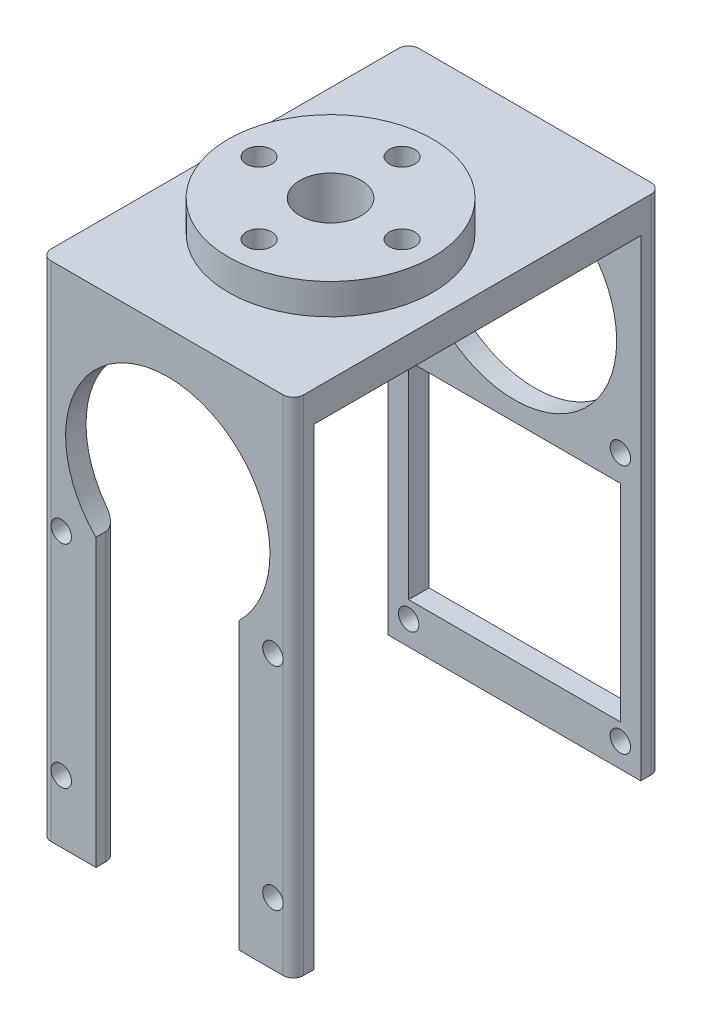
from build123d import *

# Parameters (mm, degrees)
SKETCH_1_W          = 24.72
SKETCH_1_H          = 49.22
EXTRUDE_1_DEPTH     = 36
SKETCH_3_W          = 24.72
SKETCH_3_H          = 32
CUT_EXTRUDE_1_DEPTH = 46.22
SKETCH_4_R          = 1
SKETCH_4_R_2        = 10
SKETCH_4_W          = 20.72
SKETCH_4_H          = 20.22
CUT_EXTRUDE_2_DEPTH = 2
SKETCH_6_R          = 1
CUT_EXTRUDE_3_DEPTH = 6
SKETCH_7_R          = 10
EXTRUDE_2_DEPTH     = 3
SKETCH_8_R          = 1.25
CUT_EXTRUDE_4_DEPTH = 8
FILLET_1_R          = 2
FILLET_2_R          = 2
FILLET_3_SIZE       = 2
FILLET_4_R          = 2
FILLET_5_R          = 1
FILLET_6_R          = 1
FILLET_7_R          = 1
FILLET_8_R          = 1
FILLET_9_R          = 1
FILLET_10_R         = 1
SKETCH_9_R          = 3
CUT_EXTRUDE_5_DEPTH = 10


# Some blends are built 0.0001 mm under size
with BuildPart() as part:
    # 草图1 → 凸台-拉伸1 (new body)
    with BuildSketch(Plane.XY):
        with Locations((12.36, 24.61)):
            Rectangle(SKETCH_1_W, SKETCH_1_H)
    extrude(amount=EXTRUDE_1_DEPTH)

    # 草图3 → 切除-拉伸1 (cut)
    with BuildSketch(Plane.XZ):
        with Locations((12.36, 18)):
            Rectangle(SKETCH_3_W, SKETCH_3_H)
    extrude(amount=-CUT_EXTRUDE_1_DEPTH, mode=Mode.SUBTRACT)

    # 草图4 → 切除-拉伸2 (cut)
    with BuildSketch(Plane.XY.offset(2)):
        with Locations((2, 2.36)):
            Circle(SKETCH_4_R)
        with Locations((22.72, 2.36)):
            Circle(SKETCH_4_R)
        with Locations((22.72, 26.81)):
            Circle(SKETCH_4_R)
        with Locations((2, 26.81)):
            Circle(SKETCH_4_R)
        with Locations((12.36, 36.11)):
            Circle(SKETCH_4_R_2)
        with Locations((12.36, 14.11)):
            Rectangle(SKETCH_4_W, SKETCH_4_H)
    extrude(amount=-CUT_EXTRUDE_2_DEPTH, mode=Mode.SUBTRACT)

    # 草图6 → 切除-拉伸3 (cut)
    with BuildSketch(Plane.XY.offset(36)):
        with BuildLine():
            Line((5.4, 27.996527822), (5.4, 28))
            Line((5.4, 28), (19.4, 28))
            Line((19.4, 28), (19.4, 27.940836898))
            ThreePointArc((19.4, 27.940836898), (21.640245754, 31.218722824), (22.428407613, 35.11))
            ThreePointArc((22.428407613, 35.11), (8.573804918, 44.337244337), (5.4, 27.996527822))
        make_face()
        with BuildLine():
            Line((19.4, 28), (5.4, 28))
            Line((5.4, 28), (5.4, 27.996527822))
            ThreePointArc((5.4, 27.996527822), (12.388628696, 25.110079118), (19.4, 27.940836898))
            Line((19.4, 27.940836898), (19.4, 28))
        make_face()
        with BuildLine():
            ThreePointArc((19.4, 27.940836898), (12.388628696, 25.110079118), (5.4, 27.996527822))
            Line((5.4, 27.996527822), (5.4, 0))
            Line((5.4, 0), (19.4, 0))
            Line((19.4, 0), (19.4, 27.940836898))
        make_face()
        with Locations((2, 26.81)):
            Circle(SKETCH_6_R)
        with Locations((22.72, 6.11)):
            Circle(SKETCH_6_R)
        with Locations((2, 6.11)):
            Circle(SKETCH_6_R)
        with Locations((22.72, 26.81)):
            Circle(SKETCH_6_R)
    extrude(amount=-CUT_EXTRUDE_3_DEPTH, mode=Mode.SUBTRACT)

    # 草图7 → 凸台-拉伸2 (add)
    with BuildSketch(Plane(origin=(0, 49.22, 0), x_dir=(1, 0, 0), z_dir=(0, 1, 0))):
        with Locations(Location((12.36, -20, 0), (0, 0, 270))):
            Circle(SKETCH_7_R)
    extrude(amount=EXTRUDE_2_DEPTH)

    # 草图8 → 切除-拉伸4 (cut)
    with BuildSketch(Plane(origin=(0, 52.22, 0), x_dir=(1, 0, 0), z_dir=(0, 1, 0))):
        with Locations(Location((12.36, -13, 0), (0, 0, 270))):
            Circle(SKETCH_8_R)
        with Locations(Location((12.36, -27, 0), (0, 0, 270))):
            Circle(SKETCH_8_R)
        with Locations(Location((19.36, -20, 0), (0, 0, 270))):
            Circle(SKETCH_8_R)
        with Locations(Location((5.36, -20, 0), (0, 0, 270))):
            Circle(SKETCH_8_R)
    extrude(amount=-CUT_EXTRUDE_4_DEPTH, mode=Mode.SUBTRACT)

    # 圆角1
    fillet_1_edges = [part.edges().sort_by_distance(p)[0] for p in [
        (12.36, 46.22, 11.75),
    ]]
    fillet(fillet_1_edges, radius=FILLET_1_R)

    # 圆角2
    fillet_2_edges = [part.edges().sort_by_distance(p)[0] for p in [
        (19.36, 46.22, 18.75),
    ]]
    fillet(fillet_2_edges, radius=FILLET_2_R)

    # 圆角3
    # a fillet whose section is not a circle: 2 mm, written as the material it takes off along each edge
    with BuildSketch(Plane(origin=(12.36, 46.22, 27), x_dir=(0, 0, 1), z_dir=(-1, 0, 0))) as fillet_3_piece_1:
        with BuildLine():
            Bezier((1.25 + FILLET_3_SIZE, 0), (1.25, 0), (1.25, FILLET_3_SIZE), weights=[1, 1, 1])
            Line((1.25, FILLET_3_SIZE), (1.25, 0))
            Line((1.25, 0), (1.25 + FILLET_3_SIZE, 0))
        make_face()
    revolve(axis=Axis((12.36, 46.22, 27), (0, 1, 0)), mode=Mode.SUBTRACT)

    # 圆角4
    fillet_4_edges = [part.edges().sort_by_distance(p)[0] for p in [
        (5.36, 46.22, 18.75),
    ]]
    fillet(fillet_4_edges, radius=FILLET_4_R)

    # 圆角5
    fillet_5_edges = [part.edges().sort_by_distance(p)[0] for p in [
        (0, 24.61, 36),
    ]]
    fillet(fillet_5_edges, radius=FILLET_5_R - 0.0001)  # a hair under: the kernel refuses the full size

    # 圆角6
    fillet_6_edges = [part.edges().sort_by_distance(p)[0] for p in [
        (24.72, 24.61, 36),
    ]]
    fillet(fillet_6_edges, radius=FILLET_6_R - 0.0001)  # a hair under: the kernel refuses the full size

    # 圆角7
    fillet_7_edges = [part.edges().sort_by_distance(p)[0] for p in [
        (0, 24.61, 0),
    ]]
    fillet(fillet_7_edges, radius=FILLET_7_R - 0.0001)  # a hair under: the kernel refuses the full size

    # 圆角8
    fillet_8_edges = [part.edges().sort_by_distance(p)[0] for p in [
        (24.72, 24.61, 0),
    ]]
    fillet(fillet_8_edges, radius=FILLET_8_R - 0.0001)  # a hair under: the kernel refuses the full size

    # 圆角9
    fillet_9_edges = [part.edges().sort_by_distance(p)[0] for p in [
        (19.4, 13.970418449, 34),
    ]]
    fillet(fillet_9_edges, radius=FILLET_9_R)

    # 圆角10
    fillet_10_edges = [part.edges().sort_by_distance(p)[0] for p in [
        (5.4, 13.998263911, 34),
    ]]
    fillet(fillet_10_edges, radius=FILLET_10_R)

    # 草图9 → 切除-拉伸5 (cut)
    with BuildSketch(Plane(origin=(0, 52.22, 0), x_dir=(1, 0, 0), z_dir=(0, 1, 0))):
        with Locations(Location((12.36, -20, 0), (0, 0, 270))):
            Circle(SKETCH_9_R)
    extrude(amount=-CUT_EXTRUDE_5_DEPTH, mode=Mode.SUBTRACT)


solid = part.part
